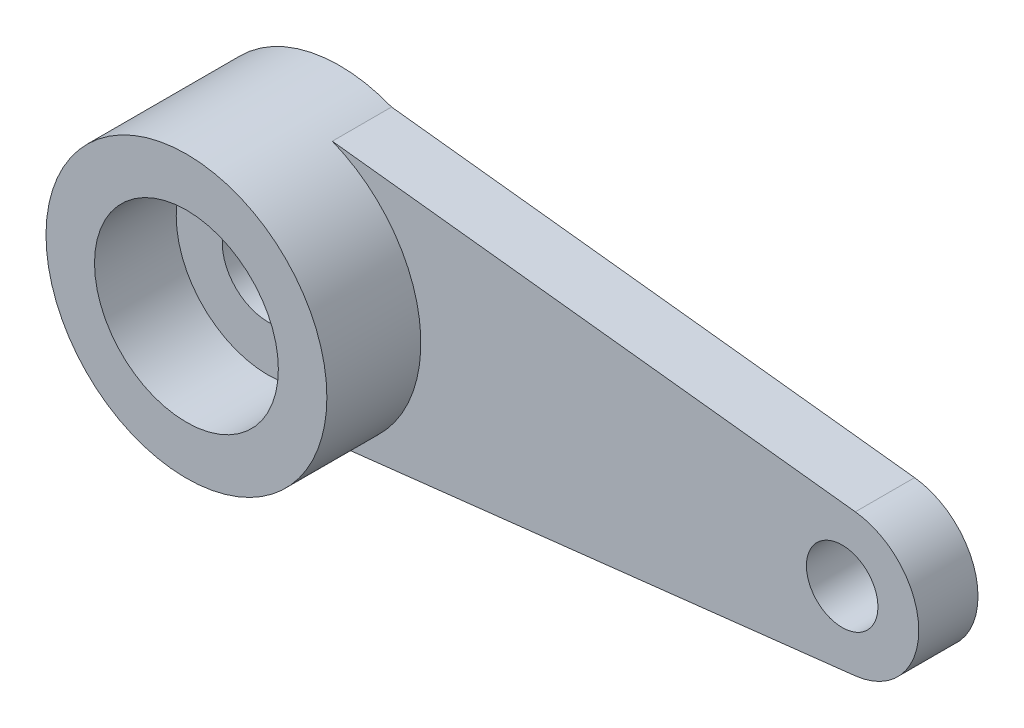
from build123d import *

# Parameters (mm, degrees)
SKETCH2_R           = 3.4925
BOSS_EXTRUDE1_DEPTH = 3.81
SKETCH3_R           = 2.286
CUT_EXTRUDE1_DEPTH  = 2.032
SKETCH4_R           = 1.143
CUT_EXTRUDE2_DEPTH  = 2.2225
CUT_EXTRUDE3_START  = -1.016
SKETCH5_R           = 2.286
CUT_EXTRUDE3_DEPTH  = 1.016
SKETCH6_R           = 0.889
BOSS_EXTRUDE2_DEPTH = 1.4732


with BuildPart() as part:
    # Sketch2 → Boss-Extrude1 (new body)
    with BuildSketch(Plane.XY):
        Circle(SKETCH2_R)
    extrude(amount=BOSS_EXTRUDE1_DEPTH)

    # Sketch3 → Cut-Extrude1 (cut)
    with BuildSketch(Plane.XY.offset(3.81)):
        Circle(SKETCH3_R)
    extrude(amount=-CUT_EXTRUDE1_DEPTH, mode=Mode.SUBTRACT)

    # Sketch4 → Cut-Extrude2 (cut)
    with BuildSketch(Plane.XY.offset(1.778)):
        Circle(SKETCH4_R)
    extrude(amount=-CUT_EXTRUDE2_DEPTH, mode=Mode.SUBTRACT)

    # Sketch5 → Cut-Extrude3 (cut)
    with BuildSketch(Plane(origin=(0, 0, 0), x_dir=(-1, 0, 0), z_dir=(0, 0, -1)).offset(CUT_EXTRUDE3_START)):
        Circle(SKETCH5_R)
    extrude(amount=CUT_EXTRUDE3_DEPTH, mode=Mode.SUBTRACT)

    # Sketch6 → Boss-Extrude2 (add)
    with BuildSketch(Plane(origin=(0, 0, 0), x_dir=(-1, 0, 0), z_dir=(0, 0, -1))):
        with BuildLine():
            Line((-1.290988646, 3.245135523), (-14.297815634, 1.766623073))
            ThreePointArc((-14.297815634, 1.766623073), (-15.875, 0), (-14.297815634, -1.766623073))
            Line((-14.297815634, -1.766623073), (-1.290988646, -3.245135523))
            ThreePointArc((-1.290988646, -3.245135523), (-3.4925, 0), (-1.290988646, 3.245135523))
        make_face()
        with Locations((-13.97, 0)):
            Circle(SKETCH6_R, mode=Mode.SUBTRACT)
    extrude(amount=-BOSS_EXTRUDE2_DEPTH)


solid = part.part
